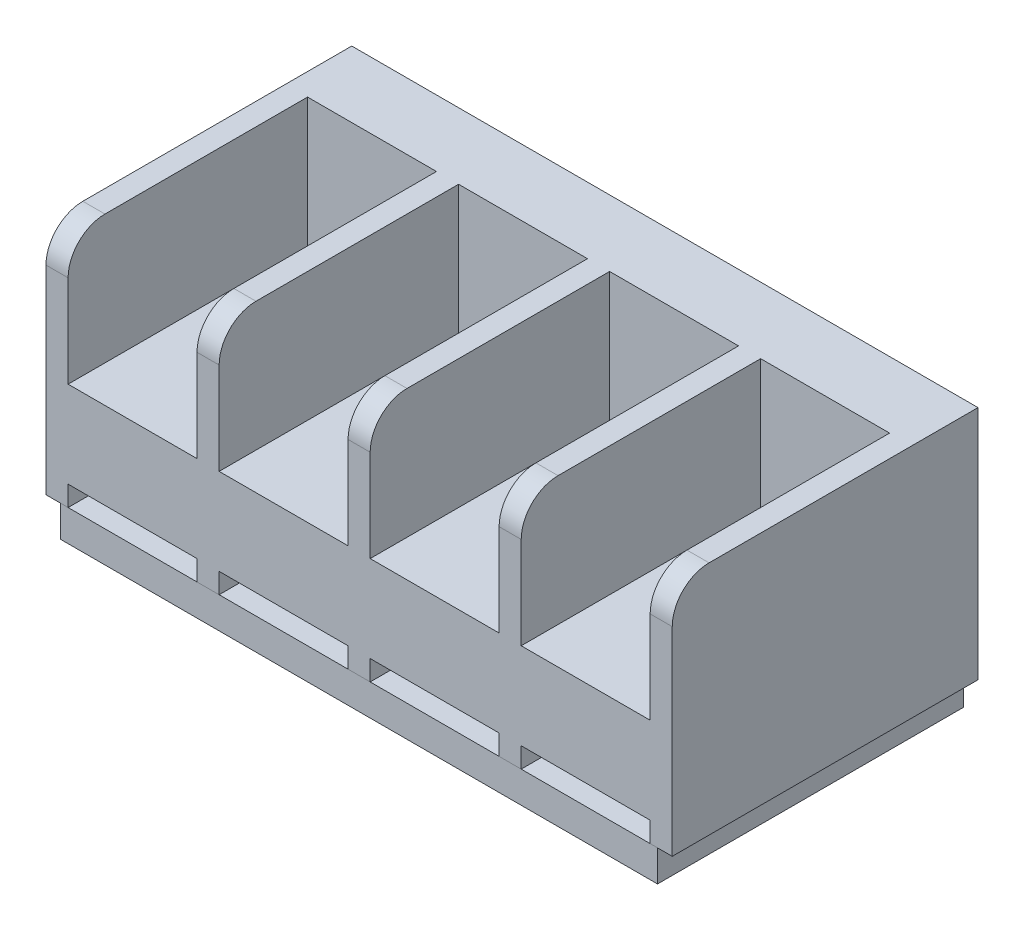
from build123d import *

# Parameters (mm, degrees)
SKETCH1_W                 = 34
SKETCH1_H                 = 16.6
BOSS_EXTRUDE1_DEPTH       = 12.8
SKETCH2_W                 = 7
SKETCH2_H                 = 16.6
CUT_EXTRUDE1_DEPTH        = 1.1
FILL_PATTERN1_OUTLINE_W   = 7
FILL_PATTERN1_OUTLINE_H   = 16.6
FILL_PATTERN1_DEPTH       = 1.1
FILLET1_R                 = 2
SKETCH3_W                 = 7
SKETCH3_H                 = 13
CUT_EXTRUDE2_DEPTH        = 7
M3X0_5_TAPPED_HOLE1_D     = 2.5
FILL_START                = 5.8
FILL_PATTERN2_OUTLINE_W   = 7
FILL_PATTERN2_OUTLINE_H   = 13
FILL_PATTERN2_DEPTH       = 7
FILL_START_2              = 1.1
FILL_PATTERN2_2_OUTLINE_R = 1.25
FILL_PATTERN2_2_DEPTH     = 4.7
SKETCH4_W                 = 32.4
SKETCH4_H                 = 16.6
BOSS_EXTRUDE2_DEPTH       = 1.7


# Read off the part's stored shape, not the designer's step: Fill Pattern1, Fill Pattern2
with BuildPart() as part:
    # Sketch1 → Boss-Extrude1 (new body)
    with BuildSketch(Plane(origin=(0, 0, 0), x_dir=(1, 0, 0), z_dir=(0, 1, 0))):
        Rectangle(SKETCH1_W, SKETCH1_H)
    extrude(amount=BOSS_EXTRUDE1_DEPTH)

    # Sketch2 → Cut-Extrude1 (cut)
    with BuildSketch(Plane.XZ):
        with Locations((-12.3, 0)):
            Rectangle(SKETCH2_W, SKETCH2_H)
    extrude(amount=-CUT_EXTRUDE1_DEPTH, mode=Mode.SUBTRACT)

    # Fill Pattern1 outline → Fill Pattern1 (cut)
    with BuildSketch(Plane(origin=(0, 0, 0), x_dir=(1, 0, 0), z_dir=(0, 1, 0))):
        with Locations((12.3, 0)):
            Rectangle(FILL_PATTERN1_OUTLINE_W, FILL_PATTERN1_OUTLINE_H)
        with Locations((4.1, 0)):
            Rectangle(FILL_PATTERN1_OUTLINE_W, FILL_PATTERN1_OUTLINE_H)
        with Locations((-4.1, 0)):
            Rectangle(FILL_PATTERN1_OUTLINE_W, FILL_PATTERN1_OUTLINE_H)
    extrude(amount=FILL_PATTERN1_DEPTH, mode=Mode.SUBTRACT)

    # Fillet1
    fillet1_edges = [part.edges().sort_by_distance(p)[0] for p in [
        (0, 12.8, 8.3),
    ]]
    fillet(fillet1_edges, radius=FILLET1_R)

    # Sketch3 → Cut-Extrude2 (cut)
    with BuildSketch(Plane(origin=(0, 12.8, 0), x_dir=(1, 0, 0), z_dir=(0, 1, 0))):
        with Locations((-12.3, -1.8)):
            Rectangle(SKETCH3_W, SKETCH3_H)
    extrude(amount=-CUT_EXTRUDE2_DEPTH, mode=Mode.SUBTRACT)

    # M3x0.5 Tapped Hole1 (through all)
    with Locations(Plane(origin=(0, 5.8, 0), x_dir=(1, 0, 0), z_dir=(0, 1, 0))):
        with Locations((-12.3, -1.8)):
            Hole(M3X0_5_TAPPED_HOLE1_D / 2)

    # Fill Pattern2 outline → Fill Pattern2 (cut)
    with BuildSketch(Plane(origin=(0, 0, 0), x_dir=(1, 0, 0), z_dir=(0, 1, 0)).offset(FILL_START)):
        with Locations((12.3, -1.8)):
            Rectangle(FILL_PATTERN2_OUTLINE_W, FILL_PATTERN2_OUTLINE_H)
        with Locations((-4.1, -1.8)):
            Rectangle(FILL_PATTERN2_OUTLINE_W, FILL_PATTERN2_OUTLINE_H)
        with Locations((4.1, -1.8)):
            Rectangle(FILL_PATTERN2_OUTLINE_W, FILL_PATTERN2_OUTLINE_H)
    extrude(amount=FILL_PATTERN2_DEPTH, mode=Mode.SUBTRACT)

    # Fill Pattern2 2 outline → Fill Pattern2 2 (cut)
    with BuildSketch(Plane(origin=(0, 0, 0), x_dir=(1, 0, 0), z_dir=(0, 1, 0)).offset(FILL_START_2)):
        with Locations((12.3, -1.8)):
            Circle(FILL_PATTERN2_2_OUTLINE_R)
        with Locations((4.1, -1.8)):
            Circle(FILL_PATTERN2_2_OUTLINE_R)
        with Locations((-4.1, -1.8)):
            Circle(FILL_PATTERN2_2_OUTLINE_R)
    extrude(amount=FILL_PATTERN2_2_DEPTH, mode=Mode.SUBTRACT)


with BuildPart() as body_2:
    # Sketch4 → Boss-Extrude2 (new body)
    with BuildSketch(Plane.XZ):
        Rectangle(SKETCH4_W, SKETCH4_H)
    extrude(amount=BOSS_EXTRUDE2_DEPTH)


solid = Compound([part.part, body_2.part])
